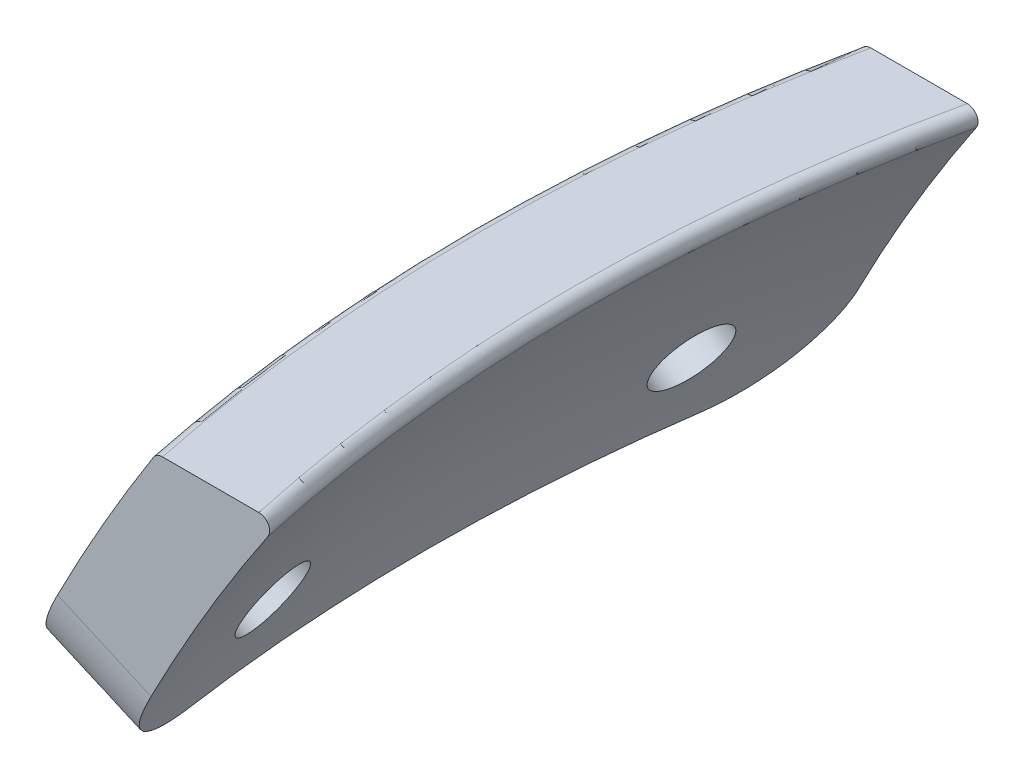
from build123d import *

# Parameters (mm, degrees)
REVOLVE1_ANGLE      = 25
SKETCH5_OUTSIDE_W   = 47.781
SKETCH5_OUTSIDE_H   = 97.38
SKETCH5_OUTSIDE_W_2 = 49.942234294
SKETCH5_OUTSIDE_H_2 = 67.217175432
CUT_EXTRUDE2_DEPTH  = 268.877927486
FILLET1_R           = 10
FILLET2_R           = 1


with BuildPart() as part:
    # Sketch1 → Revolve1 (revolve, symmetric)
    with BuildSketch(Plane.XY) as revolve1_sk:
        with BuildLine():
            Line((-166.646098372, 194.668503093), (-155.279281385, 194.668503093))
            ThreePointArc((-155.279281385, 194.668503093), (-159.25687536, 188.517911488), (-162.990977288, 182.216521665))
            ThreePointArc((-162.990977288, 182.216521665), (-167.266980695, 174.222899727), (-171.151245399, 166.031765218))
            Line((-171.151245399, 166.031765218), (-179.853851097, 169.903493393))
            ThreePointArc((-179.853851097, 169.903493393), (-173.691911648, 182.521693425), (-166.646098372, 194.668503093))
        make_face()
    revolve(axis=Axis((0, 0, 0), (0, 1, 0)), revolution_arc=REVOLVE1_ANGLE / 2)
    revolve(revolve1_sk.sketch, axis=Axis((0, 0, 0), (0, -1, 0)), revolution_arc=REVOLVE1_ANGLE / 2)

    # Sketch4 → Cut-Revolve1 (revolve, cut)
    with BuildSketch(Plane(origin=(36.360369904, 71.361243959, 0), x_dir=(-0.8910065241883692, 0.45399049973954425, 0), z_dir=(0.4539904997395442, 0.8910065241883691, 0))):
        Polygon((219.568830697, 22.795302532), (238.837118843, 24.48105931), (239.148428262, 20.922776373), (219.880140115, 19.237019595), align=None)
    cut_revolve1 = revolve(axis=Axis((-159.554269478, 171.184738652, 19.237019595), (-0.8876159753616076, 0.45226292882455665, 0.08715574274765846)), mode=Mode.SUBTRACT)

    # Mirror1: Cut-Revolve1 across plane
    add(cut_revolve1.mirror(Plane.XY), mode=Mode.SUBTRACT)

    # Sketch5 outside → Cut-Extrude2 (cut, through all)
    with BuildSketch(Plane(origin=(0, 0, 0), x_dir=(1, 0, 0), z_dir=(0, 1, 0))):
        with Locations((-165.7265, 0)):
            Rectangle(SKETCH5_OUTSIDE_W, SKETCH5_OUTSIDE_H)
        with Locations((-176.569659552, 0)):
            Rectangle(SKETCH5_OUTSIDE_W_2, SKETCH5_OUTSIDE_H_2, mode=Mode.SUBTRACT)
    extrude(amount=CUT_EXTRUDE2_DEPTH, mode=Mode.SUBTRACT)

    # Fillet1
    fillet1_edges = [part.edges().sort_by_distance(p)[0] for p in [
        (-172.252725727, 167.96686152, -33.608587716),
        (-172.252725727, 167.96686152, 33.608587716),
    ]]
    fillet(fillet1_edges, radius=FILLET1_R)

    # Fillet2
    fillet2_edges = [part.edges().sort_by_distance(p)[0] for p in [
        (-166.646098372, 194.668503093, 0),
        (-155.279281385, 194.668503093, 0),
    ]]
    fillet(fillet2_edges, radius=FILLET2_R)


solid = part.part
